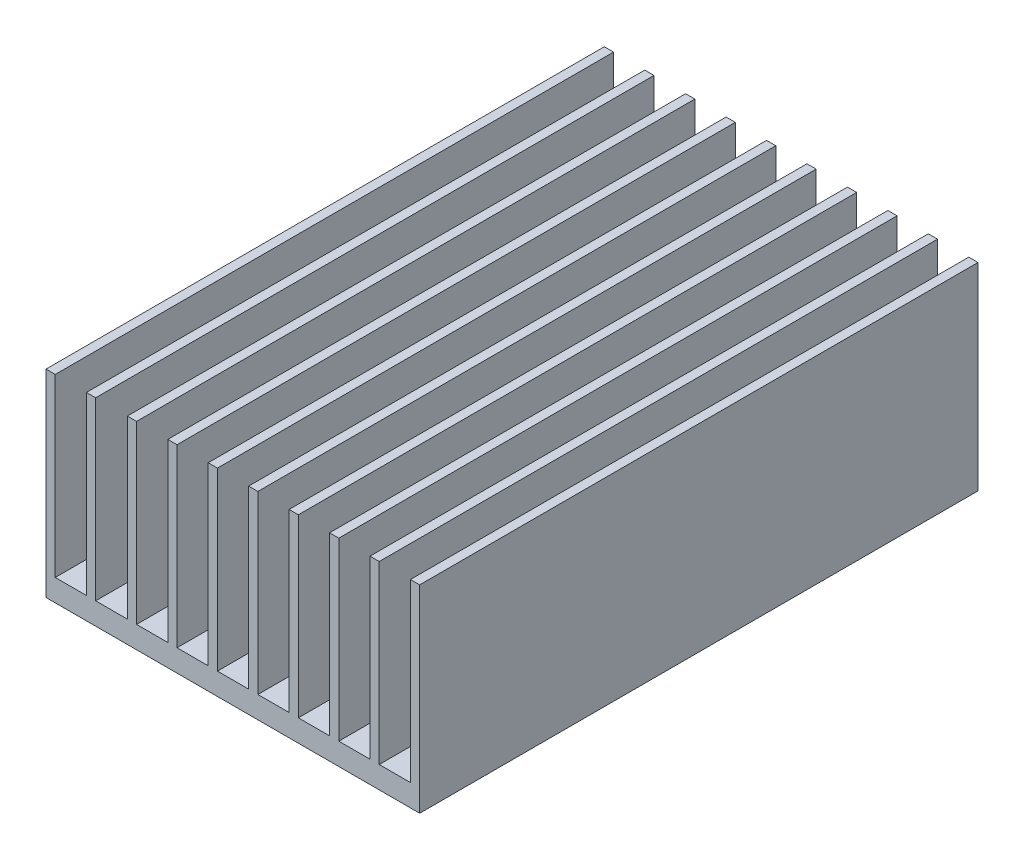
from build123d import *

# Parameters (mm, degrees)
BOSS_EXTRUDE1_DEPTH = 127
SKETCH4_W           = 13.371208708
SKETCH4_H           = 24.013599311
THERMAL_PASTE_DEPTH = 2


with BuildPart() as part:
    # Sketch1 → Boss-Extrude1 (new body)
    with BuildSketch(Plane(origin=(0, 0, -127), x_dir=(-1, 0, 0), z_dir=(0, 0, -1))):
        Polygon((85, 45), (82.9, 45), (82.9, 5), (75.8, 5), (75.8, 45), (73.7, 45), (73.7, 5), (66.5, 5), (66.5, 45), (64.4, 45), (64.4, 5), (57.3, 5), (57.3, 45), (55.2, 45), (55.2, 5), (48.1, 5), (48.1, 45), (46, 45), (46, 5), (38.9, 5), (38.9, 45), (36.8, 45), (36.8, 5), (29.7, 5), (29.7, 45), (27.6, 45), (27.6, 5), (20.5, 5), (20.5, 45), (18.4, 45), (18.4, 5), (11.3, 5), (11.3, 45), (9.2, 45), (9.2, 5), (2.1, 5), (2.1, 45), (0, 45), (0, 0), (85, 0), align=None)
    extrude(amount=-BOSS_EXTRUDE1_DEPTH)

    # Sketch4 → thermal-paste (add)
    with BuildSketch(Plane(origin=(0, 0, 0), x_dir=(-1, 0, 0), z_dir=(0, -1, 0))):
        with Locations((39.975843254, 66.911022629)):
            Rectangle(SKETCH4_W, SKETCH4_H)
    extrude(amount=THERMAL_PASTE_DEPTH)


with BuildPart() as body_2:
    # Split1: the piece on the far side of the plane
    add(part.part)
    split(bisect_by=Plane(origin=(0, 0, 0), x_dir=(0, 0, -1), z_dir=(0, -1, 0)), keep=Keep.BOTTOM)


with BuildPart() as part_1:
    add(part.part)

    # Split1
    split(bisect_by=Plane(origin=(0, 0, 0), x_dir=(0, 0, -1), z_dir=(0, -1, 0)), keep=Keep.TOP)


solid = Compound([body_2.part, part_1.part])
